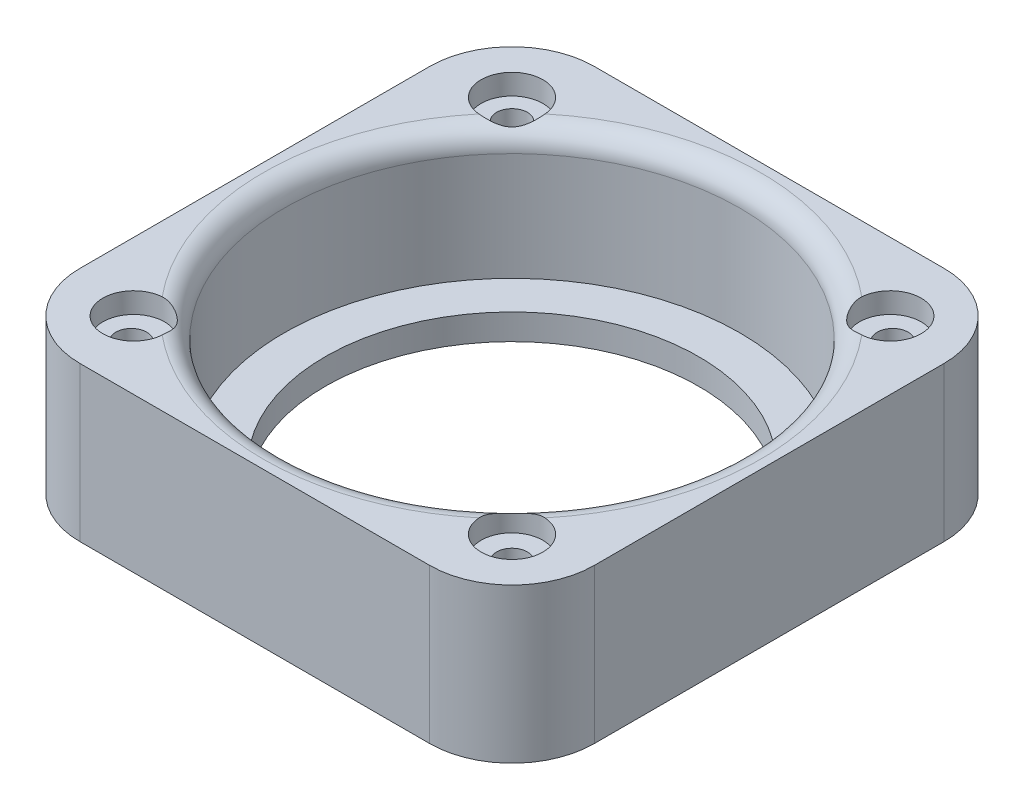
from build123d import *
from build123d.topology import SkipClean

# Parameters (mm, degrees)
SKETCH_1_R               = 25
EXTRUDE_1_DEPTH          = 15
SKETCH_2_R               = 22.15
CUT_EXTRUDE_1_DEPTH      = 12.5
SKETCH_3_R               = 18.15
CUT_EXTRUDE_2_DEPTH      = 12.5
EXTRUDE_2_DEPTH          = 15
FILLET_1_R               = 8
CUT_EXTRUDE_START        = -15
SKETCH_5_R               = 1.5
CUT_EXTRUDE_3_DEPTH      = 15
SKETCH_6_R               = 3
CUT_EXTRUDE_4_DEPTH      = 2
PATTERN_CIRCULAR_1_COUNT = 4
CUT_EXTRUDE_5_DEPTH      = 10
FILLET_2_R               = 2


with BuildPart() as part:
    # 草图1 → 凸台-拉伸1 (new body)
    with BuildSketch(Plane(origin=(0, 0, 0), x_dir=(1, 0, 0), z_dir=(0, 1, 0))):
        with Locations(Location((0, 0, 0), (0, 0, 270))):
            Circle(SKETCH_1_R)
    extrude(amount=EXTRUDE_1_DEPTH)

    # 草图2 → 切除-拉伸1 (cut)
    with BuildSketch(Plane(origin=(0, 15, 0), x_dir=(1, 0, 0), z_dir=(0, 1, 0))):
        with Locations(Location((0, 0, 0), (0, 0, 270))):
            Circle(SKETCH_2_R)
    extrude(amount=-CUT_EXTRUDE_1_DEPTH, mode=Mode.SUBTRACT)

    # 草图3 → 切除-拉伸2 (cut)
    with BuildSketch(Plane(origin=(0, 2.5, 0), x_dir=(1, 0, 0), z_dir=(0, 1, 0))):
        with Locations(Location((0, 0, 0), (0, 0, 270))):
            Circle(SKETCH_3_R)
    extrude(amount=-CUT_EXTRUDE_2_DEPTH, mode=Mode.SUBTRACT)

    # 草图4 → 凸台-拉伸2 (add)
    with BuildSketch(Plane(origin=(0, 0, 0), x_dir=(1, 0, 0), z_dir=(0, 1, 0))):
        with BuildLine():
            Line((0, 25), (-25, 25))
            Line((-25, 25), (-25, 2.6e-08))
            ThreePointArc((-25, 2.6e-08), (-23.301207713, 9.058350794), (-18.435702489, 16.885641052))
            ThreePointArc((-18.435702489, 16.885641052), (-19.445436483, 19.445436483), (-16.885641052, 18.435702489))
            ThreePointArc((-16.885641052, 18.435702489), (-9.058350782, 23.301207718), (0, 25))
        make_face()
        with BuildLine():
            Line((25, 25), (0, 25))
            ThreePointArc((0, 25), (9.210354363, 23.241544108), (17.125028574, 18.213549801))
            ThreePointArc((17.125028574, 18.213549801), (19.682469279, 19.438809921), (18.425448396, 16.896829626))
            ThreePointArc((18.425448396, 16.896829626), (23.298457137, 9.065423048), (25, 0))
            Line((25, 0), (25, 25))
        make_face()
        with BuildLine():
            ThreePointArc((-18.213549801, -17.125028574), (-23.241544113, -9.210354351), (-25, 2.6e-08))
            Line((-25, 2.6e-08), (-25, -25))
            Line((-25, -25), (-5.8e-08, -25))
            ThreePointArc((-5.8e-08, -25), (-9.065423076, -23.298457126), (-16.896829626, -18.425448396))
            ThreePointArc((-16.896829626, -18.425448396), (-19.438809921, -19.682469279), (-18.213549801, -17.125028574))
        make_face()
        with BuildLine():
            Line((25, -25), (25, 0))
            ThreePointArc((25, 0), (23.22561674, -9.250444694), (18.154341838, -17.18778265))
            ThreePointArc((18.154341838, -17.18778265), (19.675883861, -19.675883861), (17.18778265, -18.154341838))
            ThreePointArc((17.18778265, -18.154341838), (9.250444666, -23.225616751), (-5.8e-08, -25))
            Line((-5.8e-08, -25), (25, -25))
        make_face()
    extrude(amount=EXTRUDE_2_DEPTH)

    # 圆角1
    fillet_1_edges = [part.edges().sort_by_distance(p)[0] for p in [
        (-25, 7.5, -25),
        (25, 7.5, -25),
        (-25, 7.5, 25),
        (25, 7.5, 25),
    ]]
    fillet(fillet_1_edges, radius=FILLET_1_R)

    # 草图5 → 切除-拉伸3 (cut)
    with BuildSketch(Plane(origin=(0, 15, 0), x_dir=(1, 0, 0), z_dir=(0, 1, 0)).offset(CUT_EXTRUDE_START)):
        with Locations(Location((-18.384776311, 18.384776311, 0), (0, 0, 270))):
            Circle(SKETCH_5_R)
        with Locations(Location((18.615223689, 18.384776311, 0), (0, 0, 270))):
            Circle(SKETCH_5_R)
        with Locations(Location((18.615223689, -18.615223689, 0), (0, 0, 270))):
            Circle(SKETCH_5_R)
        with Locations(Location((-18.384776311, -18.615223689, 0), (0, 0, 270))):
            Circle(SKETCH_5_R)
    extrude(amount=CUT_EXTRUDE_3_DEPTH, mode=Mode.SUBTRACT)

    # 草图6 → 切除-拉伸4 (cut)
    with BuildSketch(Plane(origin=(0, 15, 0), x_dir=(1, 0, 0), z_dir=(0, 1, 0))):
        with Locations(Location((-18.384776311, 18.384776311, 0), (0, 0, 270))):
            Circle(SKETCH_6_R)
    cut_extrude_4 = extrude(amount=-CUT_EXTRUDE_4_DEPTH, mode=Mode.SUBTRACT)

    # 阵列(圆周)1: 切除-拉伸4 ×4 about axis
    with SkipClean():  # the faces are left unmerged after this step: merging them gives an invalid solid
        pattern_circular_1_axis = Axis((0, 0, 0), (0, 1, 0))
        for i in range(1, PATTERN_CIRCULAR_1_COUNT):
            add(cut_extrude_4.rotate(pattern_circular_1_axis, i * 360 / PATTERN_CIRCULAR_1_COUNT), mode=Mode.SUBTRACT)

    # 草图7 → 切除-拉伸5 (cut)
    with SkipClean():  # the faces are left unmerged after this step: merging them gives an invalid solid
        with BuildSketch(Plane.XZ):
            Polygon((15.541599538, 17.817622342), (17.769154642, 15.554586419), (20.842778794, 16.352187766), (21.688847841, 19.412825036), (19.461292736, 21.67586096), (16.387668585, 20.878259612), align=None)
            Polygon((-15.32413904, 17.769154642), (-16.121740388, 20.842778794), (-19.182377658, 21.688847841), (-21.445413581, 19.461292736), (-20.647812234, 16.387668585), (-17.587174964, 15.541599538), align=None)
            Polygon((17.817622342, -15.311152159), (15.554586419, -17.538707264), (16.352187766, -20.612331415), (19.412825036, -21.458400462), (21.67586096, -19.230845358), (20.878259612, -16.157221206), align=None)
            Polygon((-15.311152159, -17.587174964), (-17.538707264, -15.32413904), (-20.612331415, -16.121740388), (-21.458400462, -19.182377658), (-19.230845358, -21.445413581), (-16.157221206, -20.647812234), align=None)
        extrude(amount=-CUT_EXTRUDE_5_DEPTH, mode=Mode.SUBTRACT)

    # 圆角2
    # the kernel refuses this fillet: 2 mm, written as the material it takes off along each edge
    with BuildSketch(Plane(origin=(0, 15, 0), x_dir=(0, 0, 1), z_dir=(-1, 0, 0))) as fillet_2_piece_1:
        with BuildLine():
            CenterArc((22.15 + FILLET_2_R, -FILLET_2_R), FILLET_2_R, 90, 90)
            Line((22.15, -FILLET_2_R), (22.15, 0))
            Line((22.15, 0), (22.15 + FILLET_2_R, 0))
        make_face()
    revolve(axis=Axis((0, 15, 0), (0, 1, 0)), mode=Mode.SUBTRACT)


solid = part.part
